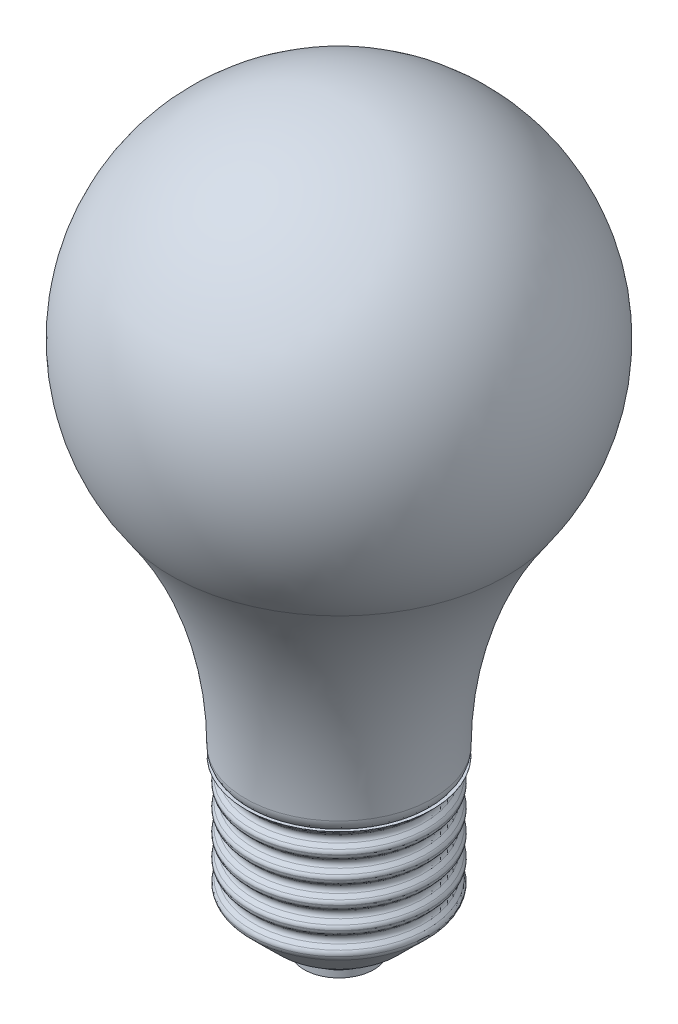
from build123d import *

# Parameters (mm, degrees)
LPATTERN1_COUNT = 5
LPATTERN1_PITCH = 3.175
FILLET1_R       = 0.762


# Read off the part's stored shape, not the designer's step: Shell1
with BuildPart() as part:
    # Sketch1 → Revolve1 (revolve)
    with BuildSketch(Plane.XY, mode=Mode.PRIVATE) as revolve1_sk:
        with BuildLine():
            Line((0, 0), (0, 107.18799999999999))
            ThreePointArc((0, 107.18799999999999), (26.797939521597456, 90.79375240187885), (24.403410480349333, 59.47016468299973))
            ThreePointArc((24.403410480349333, 59.47016468299973), (16.359769401139758, 43.5956952197664), (13.588999999999997, 26.016679903885294))
            ThreePointArc((13.588999999999997, 26.016679903885294), (13.457959273997682, 25.28203334305193), (13.080999999999996, 24.638))
            Line((13.080999999999996, 24.638), (13.588999999999995, 24.638))
            ThreePointArc((13.588999999999995, 24.638), (13.22978975515723, 24.489210244842766), (13.080999999999996, 24.13))
            Line((13.080999999999996, 24.13), (13.081, 8.786335151479129))
            ThreePointArc((13.081, 8.786335151479129), (12.982596229384008, 8.29616959241446), (12.702634212136727, 7.881963307740435))
            Line((12.702634212136727, 7.881963307740435), (8.572499999999998, 3.8099999999999996))
            Line((8.572499999999998, 3.8099999999999996), (7.873999999999999, 3.81))
            Line((7.873999999999999, 3.81), (5.08, 1.2699999999999994))
            Line((5.08, 1.2699999999999994), (5.08, 0.254))
            Line((5.08, 0.254), (2.286, 0.254))
            Line((2.286, 0.254), (2.286, 0))
            Line((2.286, 0), (0, 0))
        make_face()
    revolve(revolve1_sk.sketch.rotate(Axis((0, 0, 0), (0, 1, 0)), 90), axis=Axis((0, 0, 0), (0, 1, 0)))

    # Sketch2 → Cut-Revolve1 (revolve, cut)
    with BuildSketch(Plane.XY, mode=Mode.PRIVATE) as cut_revolve1_sk:
        with BuildLine():
            Line((14.653158500010424, 13.038445628078424), (14.653158500010424, 7.433019608930639))
            Line((14.653158500010424, 7.433019608930639), (12.389260857700682, 9.69691725124038))
            ThreePointArc((12.389260857700682, 9.69691725124038), (12.166076224964831, 10.235732618504532), (12.389260857700682, 10.774547985768683))
            Line((12.389260857700682, 10.774547985768683), (14.653158500010424, 13.038445628078424))
        make_face()
    cut_revolve1 = revolve(cut_revolve1_sk.sketch.rotate(Axis((0, 0, 0), (0, 1, 0)), 90), axis=Axis((0, 0, 0), (0, 1, 0)), mode=Mode.SUBTRACT)

    # LPattern1: Cut-Revolve1 ×5
    with Locations(*[(0, i * LPATTERN1_PITCH, 0) for i in range(1, LPATTERN1_COUNT)]):
        add(cut_revolve1, mode=Mode.SUBTRACT)

    # Fillet1
    # the kernel refuses this fillet: 0.762 mm, written as the material it takes off along each edge
    with BuildSketch(Plane(origin=(0, 20.991287128067995, 0), x_dir=(1.1e-16, 0, -1), z_dir=(-1, 0, -1.1e-16))) as fillet1_piece_1:
        with BuildLine():
            CenterArc((13.080999999999996 - FILLET1_R, -FILLET1_R * 0.414213562373), FILLET1_R, 0, 45)
            Line((13.080999999999996 - FILLET1_R * 0.292893218813, FILLET1_R * 0.292893218813), (13.080999999999996, 0))
            Line((13.080999999999996, 0), (13.080999999999996, -FILLET1_R * 0.414213562373))
        make_face()
    revolve(axis=Axis((0, 20.991287128067995, 0), (0, -1, 0)), mode=Mode.SUBTRACT)
    with BuildSketch(Plane(origin=(0, 21.70517810894107, 0), x_dir=(1.1e-16, 0, -1), z_dir=(-1, 0, -1.1e-16))) as fillet1_piece_2:
        with BuildLine():
            CenterArc((13.080999999999996 - FILLET1_R, FILLET1_R * 0.414213562373), FILLET1_R, 315, 45)
            Line((13.080999999999994, FILLET1_R * 0.414213562373), (13.080999999999996, 0))
            Line((13.080999999999996, 0), (13.080999999999996 - FILLET1_R * 0.292893218813, -FILLET1_R * 0.292893218813))
        make_face()
    revolve(axis=Axis((0, 21.70517810894107, 0), (0, -1, 0)), mode=Mode.SUBTRACT)
    with BuildSketch(Plane(origin=(0, 17.816287128067998, 0), x_dir=(1.1e-16, 0, -1), z_dir=(-1, 0, -1.1e-16))) as fillet1_piece_3:
        with BuildLine():
            CenterArc((13.080999999999996 - FILLET1_R, -FILLET1_R * 0.414213562373), FILLET1_R, 0, 45)
            Line((13.080999999999996 - FILLET1_R * 0.292893218813, FILLET1_R * 0.292893218813), (13.080999999999996, 0))
            Line((13.080999999999996, 0), (13.080999999999996, -FILLET1_R * 0.414213562373))
        make_face()
    revolve(axis=Axis((0, 17.816287128067998, 0), (0, -1, 0)), mode=Mode.SUBTRACT)
    with BuildSketch(Plane(origin=(0, 18.530178108941065, 0), x_dir=(1.1e-16, 0, -1), z_dir=(-1, 0, -1.1e-16))) as fillet1_piece_4:
        with BuildLine():
            CenterArc((13.080999999999996 - FILLET1_R, FILLET1_R * 0.414213562373), FILLET1_R, 315, 45)
            Line((13.080999999999996, FILLET1_R * 0.414213562373), (13.080999999999996, 0))
            Line((13.080999999999996, 0), (13.080999999999996 - FILLET1_R * 0.292893218813, -FILLET1_R * 0.292893218813))
        make_face()
    revolve(axis=Axis((0, 18.530178108941065, 0), (0, -1, 0)), mode=Mode.SUBTRACT)
    with BuildSketch(Plane(origin=(0, 14.641287128067995, 0), x_dir=(1.1e-16, 0, -1), z_dir=(-1, 0, -1.1e-16))) as fillet1_piece_5:
        with BuildLine():
            CenterArc((13.080999999999996 - FILLET1_R, -FILLET1_R * 0.414213562373), FILLET1_R, 0, 45)
            Line((13.080999999999996 - FILLET1_R * 0.292893218813, FILLET1_R * 0.292893218813), (13.080999999999996, 0))
            Line((13.080999999999996, 0), (13.080999999999996, -FILLET1_R * 0.414213562373))
        make_face()
    revolve(axis=Axis((0, 14.641287128067995, 0), (0, -1, 0)), mode=Mode.SUBTRACT)
    with BuildSketch(Plane(origin=(0, 15.355178108941066, 0), x_dir=(1.1e-16, 0, -1), z_dir=(-1, 0, -1.1e-16))) as fillet1_piece_6:
        with BuildLine():
            CenterArc((13.080999999999996 - FILLET1_R, FILLET1_R * 0.414213562373), FILLET1_R, 315, 45)
            Line((13.080999999999996, FILLET1_R * 0.414213562373), (13.080999999999996, 0))
            Line((13.080999999999996, 0), (13.080999999999996 - FILLET1_R * 0.292893218813, -FILLET1_R * 0.292893218813))
        make_face()
    revolve(axis=Axis((0, 15.355178108941066, 0), (0, -1, 0)), mode=Mode.SUBTRACT)
    with BuildSketch(Plane(origin=(0, 11.466287128067997, 0), x_dir=(1.1e-16, 0, -1), z_dir=(-1, 0, -1.1e-16))) as fillet1_piece_7:
        with BuildLine():
            CenterArc((13.080999999999996 - FILLET1_R, -FILLET1_R * 0.414213562373), FILLET1_R, 0, 45)
            Line((13.080999999999996 - FILLET1_R * 0.292893218813, FILLET1_R * 0.292893218813), (13.080999999999996, 0))
            Line((13.080999999999996, 0), (13.080999999999996, -FILLET1_R * 0.414213562373))
        make_face()
    revolve(axis=Axis((0, 11.466287128067997, 0), (0, -1, 0)), mode=Mode.SUBTRACT)
    with BuildSketch(Plane(origin=(0, 12.18017810894107, 0), x_dir=(1.1e-16, 0, -1), z_dir=(-1, 0, -1.1e-16))) as fillet1_piece_8:
        with BuildLine():
            CenterArc((13.080999999999996 - FILLET1_R, FILLET1_R * 0.414213562373), FILLET1_R, 315, 44.999999999999865)
            Line((13.080999999999996, FILLET1_R * 0.414213562373), (13.080999999999996, 0))
            Line((13.080999999999996, 0), (13.080999999999996 - FILLET1_R * 0.292893218813, -FILLET1_R * 0.292893218813))
        make_face()
    revolve(axis=Axis((0, 12.18017810894107, 0), (0, -1, 0)), mode=Mode.SUBTRACT)
    with BuildSketch(Plane(origin=(0, 9.005178108941065, 0), x_dir=(1.1e-16, 0, -1), z_dir=(-1, 0, -1.1e-16))) as fillet1_piece_9:
        with BuildLine():
            CenterArc((12.31115343692058, 0.3077841714488798), FILLET1_R, 315, 55.083379399186136)
            Line((13.061383592288468, 0.441195992426918), (13.136406607825258, 0.454537174524722))
            ThreePointArc((13.136406607825258, 0.454537174524722), (13.1572, 0.21884295746193594), (13.157199999999996, 0))
            Line((13.157199999999996, 0), (13.134881536726411, -0.05388153672641494))
            Line((13.134881536726411, -0.05388153672641494), (12.903850340911145, -0.2849127325416845))
            Line((12.903850340911145, -0.2849127325416845), (12.84996880418473, -0.23103119581526954))
        make_face()
    revolve(axis=Axis((0, 9.005178108941065, 0), (0, -1, 0)), mode=Mode.SUBTRACT)
    with BuildSketch(Plane(origin=(0, 24.167686999709446, 0), x_dir=(1.2e-16, 0, -1), z_dir=(1, 0, 1.2e-16))) as fillet1_piece_10:
        with BuildLine():
            CenterArc((12.392300726311051, 0.38753158919789854), FILLET1_R, 314.9999999999999, 25.438541977538648)
            Line((12.931116093575199, -0.15128377806625082), (13.082399871641444, 0))
            ThreePointArc((13.082399871641444, 0), (13.091932038284336, 0.06713399740391779), (13.110320290524417, 0.1324004358534907))
        make_face()
    revolve(axis=Axis((0, 24.167686999709446, 0), (0, 1, 0)), mode=Mode.SUBTRACT)

    # Shell1 outline → Shell1 (revolve, cut)
    with BuildSketch(Plane.XY):
        with BuildLine():
            ThreePointArc((12.377598592, 24.384), (13.077996842, 25.070336794), (13.335, 26.016679904))
            ThreePointArc((13.335, 26.016679904), (16.118083932, 43.673824177), (24.197474527, 59.618846838))
            ThreePointArc((24.197474527, 59.618846838), (26.571796576, 90.678100476), (0, 106.934))
            Line((0, 106.934), (0, 0.254))
            Line((0, 0.254), (2.032, 0.254))
            Line((2.032, 0.254), (2.032, 0.508))
            Line((2.032, 0.508), (4.826, 0.508))
            Line((4.826, 0.508), (4.826, 1.382361951))
            Line((4.826, 1.382361951), (7.775801854, 4.064))
            Line((7.775801854, 4.064), (8.468343441, 4.064))
            Line((8.468343441, 4.064), (12.52430737, 8.062837676))
            ThreePointArc((12.52430737, 8.062837676), (12.710189851, 8.313351419), (12.811306874, 8.608452724))
            ThreePointArc((12.811306874, 8.608452724), (12.79575267, 8.849799919), (12.670363682, 9.056604182))
            Line((12.670363682, 9.056604182), (12.209655735, 9.517312129))
            ThreePointArc((12.209655735, 9.517312129), (11.912076225, 10.235732619), (12.209655735, 10.954153108))
            Line((12.209655735, 10.954153108), (12.678210245, 11.422707618))
            ThreePointArc((12.678210245, 11.422707618), (12.788330803, 11.587514679), (12.827, 11.781917863))
            Line((12.827, 11.781917863), (12.827, 11.864547374))
            ThreePointArc((12.827, 11.864547374), (12.788330803, 12.058950558), (12.678210245, 12.223757619))
            Line((12.678210245, 12.223757619), (12.209655735, 12.692312129))
            ThreePointArc((12.209655735, 12.692312129), (11.912076225, 13.410732618), (12.209655735, 14.129153108))
            Line((12.209655735, 14.129153108), (12.678210245, 14.597707618))
            ThreePointArc((12.678210245, 14.597707618), (12.788330803, 14.762514679), (12.827, 14.956917863))
            Line((12.827, 14.956917863), (12.827, 15.039547374))
            ThreePointArc((12.827, 15.039547374), (12.788330803, 15.233950558), (12.678210245, 15.398757619))
            Line((12.678210245, 15.398757619), (12.209655735, 15.867312129))
            ThreePointArc((12.209655735, 15.867312129), (11.912076225, 16.585732618), (12.209655735, 17.304153108))
            Line((12.209655735, 17.304153108), (12.678210245, 17.772707618))
            ThreePointArc((12.678210245, 17.772707618), (12.788330803, 17.937514679), (12.827, 18.131917863))
            Line((12.827, 18.131917863), (12.827, 18.214547374))
            ThreePointArc((12.827, 18.214547374), (12.788330803, 18.408950558), (12.678210245, 18.573757619))
            Line((12.678210245, 18.573757619), (12.209655735, 19.042312129))
            ThreePointArc((12.209655735, 19.042312129), (11.912076225, 19.760732619), (12.209655735, 20.479153108))
            Line((12.209655735, 20.479153108), (12.678210245, 20.947707618))
            ThreePointArc((12.678210245, 20.947707618), (12.788330803, 21.112514679), (12.827, 21.306917863))
            Line((12.827, 21.306917863), (12.827, 21.389547374))
            ThreePointArc((12.827, 21.389547374), (12.788330803, 21.583950558), (12.678210245, 21.748757619))
            Line((12.678210245, 21.748757619), (12.209655735, 22.217312129))
            ThreePointArc((12.209655735, 22.217312129), (11.912076225, 22.935732618), (12.209655735, 23.654153108))
            Line((12.209655735, 23.654153108), (12.751510971, 24.196008344))
            ThreePointArc((12.751510971, 24.196008344), (12.821464021, 24.283404559), (12.870577001, 24.384))
            Line((12.870577001, 24.384), (12.377598592, 24.384))
        make_face()
    revolve(axis=Axis((0, 0, 0), (0, 1, 0)), mode=Mode.SUBTRACT)


solid = part.part
